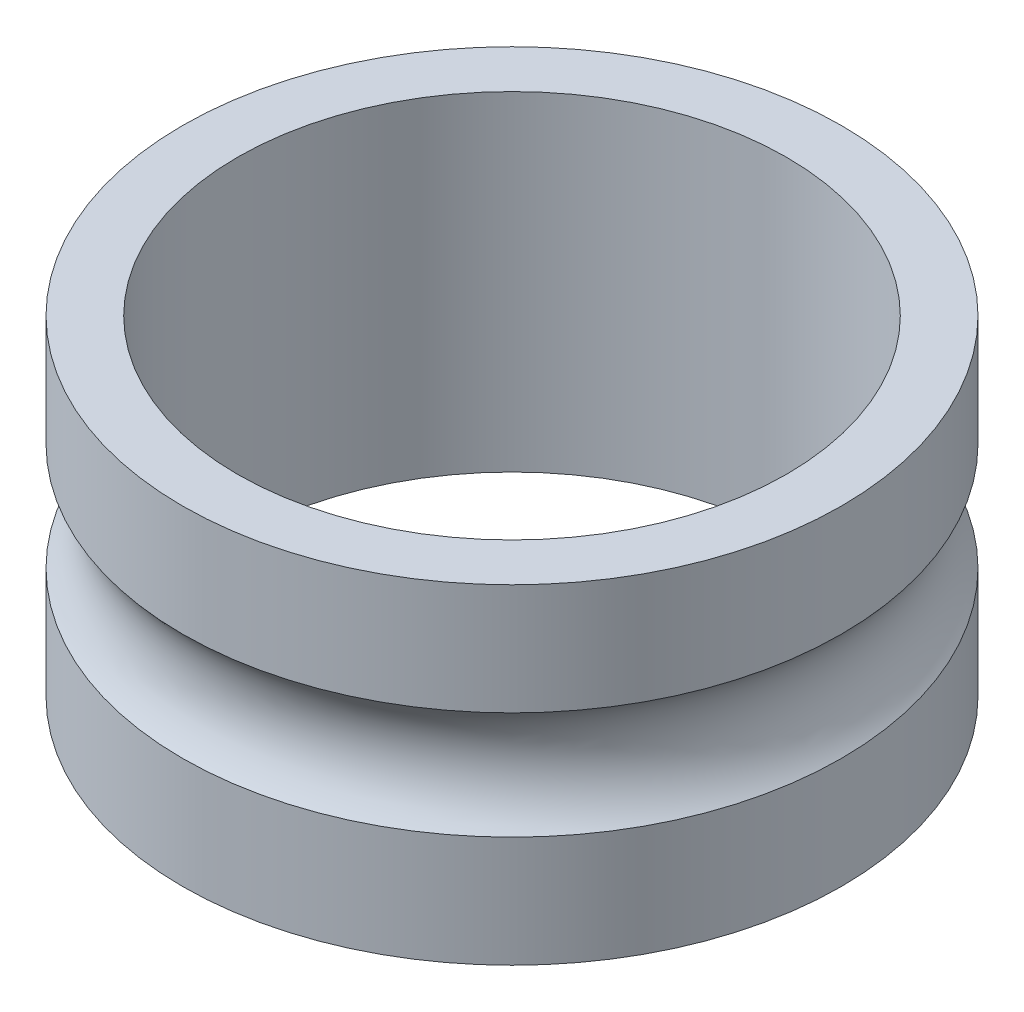
from build123d import *

# Parameters (mm, degrees)
DIAMETER_PROFILE_SKETCH_R     = 3
DIAMETER_PROFILE_SKETCH_R_2   = 2.5
DIAMETER_PROFILE_DEPTH        = 1.5
BEARING_PATH_PROFILE_SKETCH_R = 0.7


with BuildPart() as part:
    # Diameter Profile Sketch → Diameter Profile (new, symmetric)
    with BuildSketch(Plane(origin=(0, 0, 0), x_dir=(1, 0, 0), z_dir=(0, 1, 0))):
        Circle(DIAMETER_PROFILE_SKETCH_R)
        Circle(DIAMETER_PROFILE_SKETCH_R_2, mode=Mode.SUBTRACT)
    extrude(amount=DIAMETER_PROFILE_DEPTH, both=True)

    # Bearing Path Profile Sketch → Bearing Path Profile (revolve, cut)
    with BuildSketch(Plane.XY):
        with Locations((3.5, 0)):
            Circle(BEARING_PATH_PROFILE_SKETCH_R)
    revolve(axis=Axis((0, 1.5, 0), (0, -1, 0)), mode=Mode.SUBTRACT)


solid = part.part
